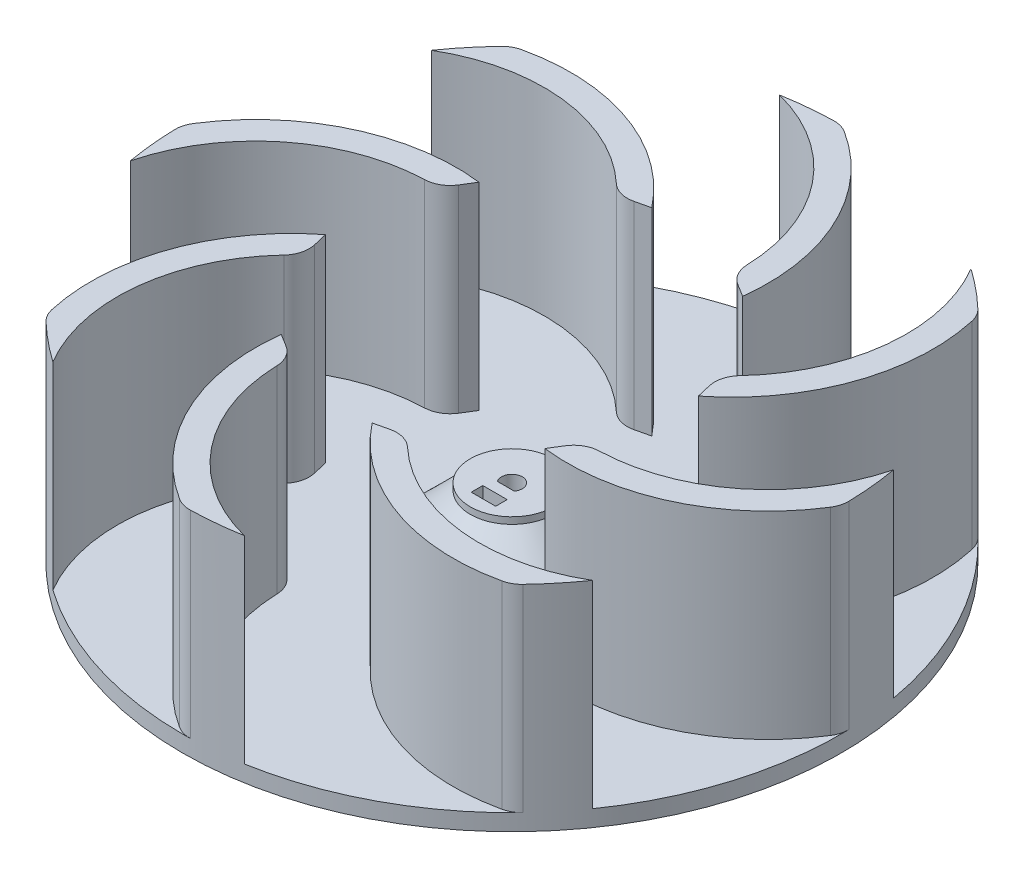
from build123d import *

# Parameters (mm, degrees)
SKETCH1_R                = 100
BOSS_EXTRUDE1_DEPTH      = 5
BOSS_EXTRUDE2_START      = 16
SKETCH1_3_R              = 12.65
SKETCH1_3_W              = 7.4
SKETCH1_3_H              = 3.5
BOSS_EXTRUDE2_DEPTH      = 16
CHAMFER1_SIZE            = 14
CUT_EXTRUDE1_DEPTH       = 146.988090268
CUT_EXTRUDE1_DEPTH_BACK  = 5.15
SKETCH3_R                = 2
FILLET1_R                = 3
BOSS_EXTRUDE3_START      = 60
BOSS_EXTRUDE3_DEPTH      = 60
FILLET3_R                = 8
FILLET4_R                = 8
CIRPATTERN1_COUNT        = 8
FILLET3_OF_CIRPATTERN1_R = 8
FILLET4_OF_CIRPATTERN1_R = 8


with BuildPart() as part:
    # Sketch1 → Boss-Extrude1 (new body)
    with BuildSketch(Plane(origin=(0, 0, 0), x_dir=(1, 0, 0), z_dir=(0, 1, 0))):
        with Locations(Location((0, 0, 0), (0, 0, 270))):
            Circle(SKETCH1_R)
        with BuildLine():
            Line((2.549509757, -1.85), (-2.549509757, -1.85))
            ThreePointArc((-2.549509757, -1.85), (0, 3.15), (2.549509757, -1.85))
        make_face(mode=Mode.SUBTRACT)
    extrude(amount=-BOSS_EXTRUDE1_DEPTH)

    # Sketch1<3> → Boss-Extrude2 (add)
    with BuildSketch(Plane(origin=(0, 0, 0), x_dir=(1, 0, 0), z_dir=(0, 1, 0)).offset(BOSS_EXTRUDE2_START)):
        with Locations(Location((0, 0, 0), (0, 0, 270))):
            Circle(SKETCH1_3_R)
        with BuildLine():
            Line((2.549509757, -1.85), (-2.549509757, -1.85))
            ThreePointArc((-2.549509757, -1.85), (0, 3.15), (2.549509757, -1.85))
        make_face(mode=Mode.SUBTRACT)
        with Locations((0, -6.9)):
            Rectangle(SKETCH1_3_W, SKETCH1_3_H, mode=Mode.SUBTRACT)
    extrude(amount=-BOSS_EXTRUDE2_DEPTH)

    # Chamfer1
    chamfer1_edges = [part.edges().sort_by_distance(p)[0] for p in [
        (0, 0, -12.65),
    ]]
    chamfer(chamfer1_edges, length=CHAMFER1_SIZE)

    # Sketch3 → Cut-Extrude1 (cut, two sides: drawn at the far end of the back side and taken through both)
    with BuildSketch(Plane.XY.offset(5.15).offset(-CUT_EXTRUDE1_DEPTH_BACK)):
        with Locations(Location((0, 8, 0), (0, 0, 180))):
            Circle(SKETCH3_R)
    extrude(amount=CUT_EXTRUDE1_DEPTH + CUT_EXTRUDE1_DEPTH_BACK, mode=Mode.SUBTRACT)

    # Fillet1
    fillet1_edges = [part.edges().sort_by_distance(p)[0] for p in [
        (3.7, 0, 6.9),
        (-3.7, 0, 6.9),
    ]]
    fillet(fillet1_edges, radius=FILLET1_R)

    # Sketch4 → Boss-Extrude3 (add)
    with BuildSketch(Plane(origin=(0, 0, 0), x_dir=(1, 0, 0), z_dir=(0, 1, 0)).offset(BOSS_EXTRUDE3_START)):
        with BuildLine():
            Line((-22.374700612, -44.714346384), (-30, -40))
            ThreePointArc((-30, -40), (-24.010405369, -74.505202685), (0, -100))
            ThreePointArc((0, -100), (8.67647844, -99.622882521), (17.287515846, -98.494374438))
            ThreePointArc((17.287515846, -98.494374438), (-12.116392899, -78.664202138), (-22.374700612, -44.714346384))
        make_face()
    boss_extrude3 = extrude(amount=-BOSS_EXTRUDE3_DEPTH)

    # Fillet3
    fillet3_edges = [part.edges().sort_by_distance(p)[0] for p in [
        (-22.374700612, 30, 44.714346384),
    ]]
    fillet(fillet3_edges, radius=FILLET3_R)

    # Fillet4
    # the kernel refuses this fillet: 8 mm, written as the material it takes off along each edge
    with BuildSketch(Plane(origin=(0, 66.107971256, 100), x_dir=(0.999929553100501, 0, -0.01186966032505709), z_dir=(0, -1, 0))) as fillet4_piece_1:
        with BuildLine():
            CenterArc((2.278974782, -7.999436425), FILLET4_R, 89.319902589, 33.659920931)
            ThreePointArc((-2.075774552, -1.288537958), (-1.044352376, -0.633854003), (0, 0))
            ThreePointArc((0, 0), (1.186966033, 0.00704469), (2.373932065, 0))
        make_face()
    extrude(amount=66.107971256, mode=Mode.SUBTRACT)

    # CirPattern1: Boss-Extrude3 ×8 about axis
    cirpattern1_axis = Axis((0, 0, 0), (0, 1, 0))
    for i in range(1, CIRPATTERN1_COUNT):
        add(boss_extrude3.rotate(cirpattern1_axis, i * 360 / CIRPATTERN1_COUNT))

    # Fillet3 of CirPattern1
    fillet3_of_cirpattern1_edges = [part.edges().sort_by_distance(p)[0] for p in [
        (15.796515014, 30, 47.439120074),
        (44.714346384, 30, 22.374700612),
        (47.439120074, 30, -15.796515014),
        (22.374700612, 30, -44.714346384),
        (-15.796515014, 30, -47.439120074),
        (-44.714346384, 30, -22.374700612),
        (-47.439120074, 30, 15.796515014),
    ]]
    fillet(fillet3_of_cirpattern1_edges, radius=FILLET3_OF_CIRPATTERN1_R)

    # Fillet4 of CirPattern1
    # the kernel refuses this fillet: 8 mm, written as the material it takes off along each edge
    with BuildSketch(Plane(origin=(70.710678119, 66.107971256, 70.710678119), x_dir=(0.6986638503999697, 0, -0.7154500850124269), z_dir=(0, -1, 0)), Plane(origin=(100, 66.107971256, 0), x_dir=(-0.01186966032505703, 0, -0.9999295531005011), z_dir=(0, -1, 0)), Plane(origin=(70.710678119, 66.107971256, -70.710678119), x_dir=(-0.7154500850124297, 0, -0.6986638503999666), z_dir=(0, -1, 0)), Plane(origin=(0, 66.107971256, -100), x_dir=(-0.999929553100501, 0, 0.011869660325056916), z_dir=(0, -1, 0))) as fillet4_of_cirpattern1_piece_1:
        with BuildLine():
            CenterArc((2.278974782, -7.999436425), FILLET4_OF_CIRPATTERN1_R, 89.319902589, 33.659920931)
            ThreePointArc((-2.075774552, -1.288537958), (-1.044352376, -0.633854003), (0, 0))
            ThreePointArc((0, 0), (1.186966033, 0.00704469), (2.373932065, 0))
        make_face()
    extrude(amount=66.107971256, mode=Mode.SUBTRACT)
    with BuildSketch(Plane(origin=(-70.710678119, 66.107971256, -70.710678119), x_dir=(0.9709251782861501, 0, -0.23938316183476163), z_dir=(0, -1, 0)), Plane(origin=(-100, 66.107971256, 0), x_dir=(0.517278320555659, 0, -0.8558172346261301), z_dir=(0, -1, 0)), Plane(origin=(-70.710678119, 66.107971256, 70.710678119), x_dir=(-0.23938316183476574, 0, -0.9709251782861491), z_dir=(0, -1, 0))) as fillet4_of_cirpattern1_piece_2:
        with BuildLine():
            CenterArc((2.282648109, 7.998389012), FILLET4_OF_CIRPATTERN1_R, 237.489942123, 33.659920931)
            ThreePointArc((-2.016933103, 1.252012103), (-1.012181922, 0.620020763), (0, 0))
            ThreePointArc((0, 0), (1.221594251, -0.012258436), (2.443188502, 0))
        make_face()
    extrude(amount=66.107971256, mode=Mode.SUBTRACT)


solid = part.part
